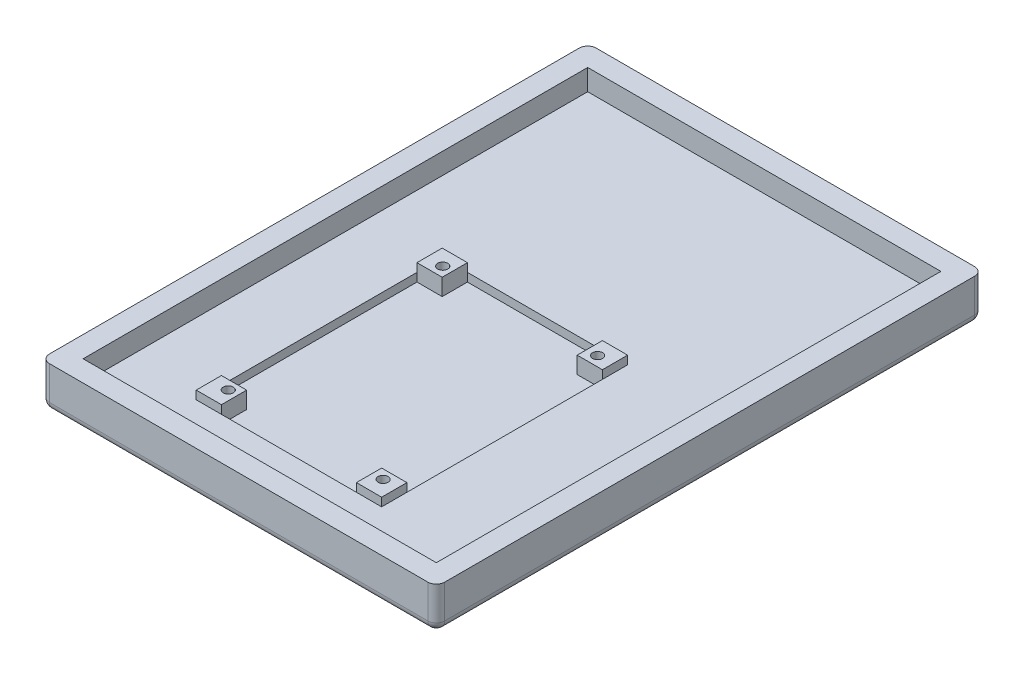
from build123d import *

# Parameters (mm, degrees)
SKETCH1_W           = 94
SKETCH1_H           = 130
BOSS_EXTRUDE1_DEPTH = 5
SKETCH2_W           = 94
SKETCH2_H           = 130
SKETCH2_W_2         = 84
SKETCH2_H_2         = 120
BOSS_EXTRUDE2_DEPTH = 5
FILLET1_R           = 2
SKETCH3_W           = 44.1
SKETCH3_H           = 58.5
CUT_EXTRUDE1_DEPTH  = 2
SKETCH5_W           = 6
SKETCH5_H           = 6
BOSS_EXTRUDE4_DEPTH = 4
SKETCH7_R           = 1.20000014
CUT_EXTRUDE2_DEPTH  = 3


with BuildPart() as part:
    # Sketch1 → Boss-Extrude1 (new body)
    with BuildSketch(Plane(origin=(0, 0, 0), x_dir=(1, 0, 0), z_dir=(0, 1, 0))):
        with Locations((47, 65)):
            Rectangle(SKETCH1_W, SKETCH1_H)
    extrude(amount=BOSS_EXTRUDE1_DEPTH)

    # Sketch2 → Boss-Extrude2 (add)
    with BuildSketch(Plane(origin=(0, 5, 0), x_dir=(1, 0, 0), z_dir=(0, 1, 0))):
        with Locations((47, 65)):
            Rectangle(SKETCH2_W, SKETCH2_H)
        with Locations((47, 65)):
            Rectangle(SKETCH2_W_2, SKETCH2_H_2, mode=Mode.SUBTRACT)
    extrude(amount=BOSS_EXTRUDE2_DEPTH)

    # Fillet1
    fillet1_edges = [part.edges().sort_by_distance(p)[0] for p in [
        (0, 5, -130),
        (0, 5, 0),
        (94, 5, 0),
        (47, 0, 0),
        (0, 0, -65),
        (94, 0, -65),
        (47, 0, -130),
        (94, 5, -130),
    ]]
    fillet(fillet1_edges, radius=FILLET1_R)

    # Sketch3 → Cut-Extrude1 (cut)
    with BuildSketch(Plane(origin=(0, 5, 0), x_dir=(1, 0, 0), z_dir=(0, 1, 0))):
        with Locations((43.95, 44.25)):
            Rectangle(SKETCH3_W, SKETCH3_H)
    extrude(amount=-CUT_EXTRUDE1_DEPTH, mode=Mode.SUBTRACT)

    # Sketch5 → Boss-Extrude4 (add)
    with BuildSketch(Plane(origin=(0, 3, 0), x_dir=(1, 0, 0), z_dir=(0, 1, 0))):
        with Locations((24.9, 70.5)):
            Rectangle(SKETCH5_W, SKETCH5_H)
        with Locations((63, 70.5)):
            Rectangle(SKETCH5_W, SKETCH5_H)
        with Locations((63, 18)):
            Rectangle(SKETCH5_W, SKETCH5_H)
        with Locations((24.9, 18)):
            Rectangle(SKETCH5_W, SKETCH5_H)
    extrude(amount=BOSS_EXTRUDE4_DEPTH)

    # Sketch7 → Cut-Extrude2 (cut)
    with BuildSketch(Plane(origin=(0, 7, 0), x_dir=(1, 0, 0), z_dir=(0, 1, 0))):
        with Locations((25.684600549, 69.839000092)):
            Circle(SKETCH7_R)
        with Locations((62.514600549, 69.839000092)):
            Circle(SKETCH7_R)
        with Locations((62.514600549, 18.835800092)):
            Circle(SKETCH7_R)
        with Locations((25.684600549, 18.835800092)):
            Circle(SKETCH7_R)
    extrude(amount=-CUT_EXTRUDE2_DEPTH, mode=Mode.SUBTRACT)


solid = part.part
